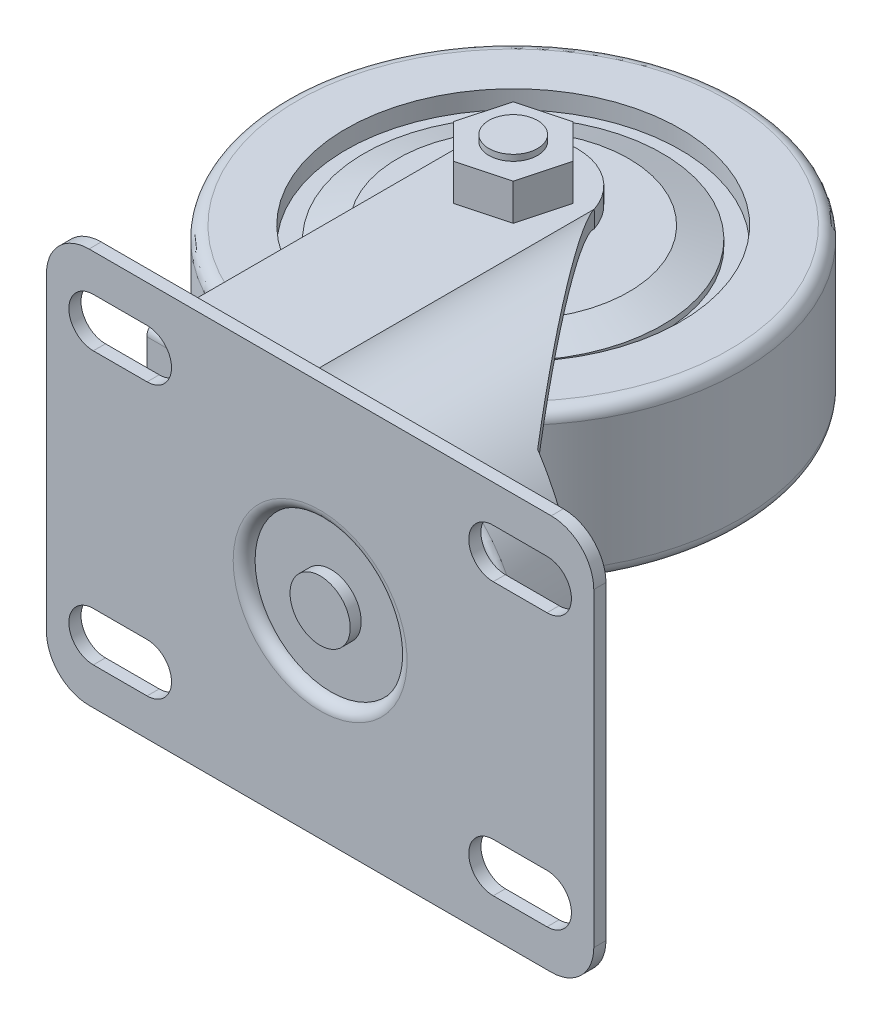
from build123d import *

# Parameters (mm, degrees)
CUT_EXTRUDE_2_DEPTH      = 85.445062578
CUT_EXTRUDE_2_DEPTH_BACK = 85.445062578
CUT_EXTRUDE_3_DEPTH      = 85.445062578
CUT_EXTRUDE_3_DEPTH_BACK = 85.445062578
EXTRUDE_6_DEPTH          = 40
EXTRUDE_7_DEPTH          = 2.8
CUT_EXTRUDE_4_DEPTH      = 103.254861861
SKETCH_18_R              = 4
EXTRUDE_8_DEPTH          = 0.3
EXTRUDE_9_DEPTH          = 6
SKETCH_20_R              = 4
EXTRUDE_10_DEPTH         = 1
EXTRUDE_START            = 0.3
SKETCH_21_R              = 4
EXTRUDE_11_DEPTH         = 0.3
SKETCH_22_R              = 5.5
EXTRUDE_12_DEPTH         = 1
FILLET_1_R               = 1
EXTRUDE_13_DEPTH         = 12.5
EXTRUDE_13_DEPTH_BACK    = 12.5
SKETCH_23_R              = 37.5
FILLET_2_R               = 2
SKETCH_24_R              = 27.5
SKETCH_24_R_2            = 24.5
CUT_EXTRUDE_5_DEPTH      = 3
CHAMFER_1_SIZE           = 2
CHAMFER_1_SIZE2          = 5.494954839
CHAMFER_2_SIZE           = 6.5
CHAMFER_2_SIZE2          = 2.365806523
SKETCH_25_R              = 6
EXTRUDE_14_DEPTH         = 3
SKETCH_33_W              = 90
SKETCH_33_H              = 65
EXTRUDE_22_DEPTH         = 2
FILLET_5_R               = 7
CUT_EXTRUDE_6_DEPTH      = 2
MIRROR_9_COPY_1_DEPTH    = 2
SKETCH_35_R              = 12.5
SKETCH_35_R_2            = 4.952549827
CUT_EXTRUDE_8_DEPTH      = 1.8
FILLET_6_R               = 1.8
CUT_EXTRUDE_9_DEPTH      = 20


# Read off the part's stored shape, not the designer's step: 加厚3
with BuildPart() as part:
    # 加厚3 outline → 加厚3 (revolve)
    with BuildSketch(Plane.XZ):
        with BuildLine():
            Line((22.51498107, -15), (22.51498107, -77))
            Line((22.51498107, -77), (24.51498107, -77))
            Line((24.51498107, -77), (24.51498107, -14))
            ThreePointArc((24.51498107, -14), (24.222087851, -13.292893219), (23.51498107, -13))
            Line((23.51498107, -13), (7.588114325, -13))
            Line((7.588114325, -13), (7.588114325, -15))
            Line((7.588114325, -15), (22.51498107, -15))
        make_face()
    revolve(axis=Axis((0, 0, 0), (0, 0, 1)))

    # 草图13 → 切除-拉伸2 (cut, two sides: drawn at the far end of the back side and taken through both)
    with BuildSketch(Plane(origin=(0, 0, 0), x_dir=(1, 0, 0), z_dir=(0, 1, 0)).offset(-CUT_EXTRUDE_2_DEPTH_BACK)):
        Polygon((-24.51498107, 77), (14.604928022, 26.16151052), (24.51498107, 23.088616514), (24.51498107, 77), align=None)
    extrude(amount=CUT_EXTRUDE_2_DEPTH + CUT_EXTRUDE_2_DEPTH_BACK, mode=Mode.SUBTRACT)

    # 草图14 → 切除-拉伸3 (cut, two sides: drawn at the far end of the back side and taken through both)
    with BuildSketch(Plane(origin=(0, 0, 0), x_dir=(1, 0, 0), z_dir=(0, 1, 0)).offset(-CUT_EXTRUDE_3_DEPTH_BACK)):
        Polygon((-16.5, 70.472511213), (-16.5, 12.57524565), (-25.363625659, 12.57524565), (-25.363625659, 79.702348144), align=None)
    extrude(amount=CUT_EXTRUDE_3_DEPTH + CUT_EXTRUDE_3_DEPTH_BACK, mode=Mode.SUBTRACT)

    # 草图15 → 凸台-拉伸6 (add)
    with BuildSketch(Plane.ZY.offset(16.5)):
        with BuildLine():
            Line((-13, -16.754233337), (-13, 16.754233337))
            add(Edge.make_bspline(
                [(-13, 16.754233337), (-13, 17.066282989), (-13.071981627, 17.383432621), (-13.278379206, 17.716834739), (-13.32508278, 17.779332115), (-13.431437184, 17.894341909), (-13.491489359, 17.946901419), (-13.686888914, 18.078052515), (-13.843794025, 18.131031324), (-14, 18.131031324)],
                knots=[0, 0, 0, 0, 0.5, 0.5, 0.625, 0.625, 0.75, 0.75, 1, 1, 1, 1], degree=3))
            Line((-14, 18.131031324), (-66.584087994, 18.131031324))
            Line((-66.584087994, 18.131031324), (-66.584087994, 15.31908524))
            Line((-66.584087994, 15.31908524), (-15, 15.31908524))
            Line((-15, 15.31908524), (-15, -15.31908524))
            Line((-15, -15.31908524), (-66.584087994, -15.31908524))
            Line((-66.584087994, -15.31908524), (-66.584087994, -18.131031324))
            Line((-66.584087994, -18.131031324), (-14, -18.131031324))
            add(Edge.make_bspline(
                [(-14, -18.131031324), (-13.842407053, -18.131031324), (-13.686831177, -18.07799673), (-13.491621762, -17.946998796), (-13.431468043, -17.894358188), (-13.325276406, -17.779558555), (-13.278292746, -17.716769524), (-13.153663134, -17.515226129), (-13.095772202, -17.370480096), (-13.018069892, -17.065294363), (-13, -16.910169012), (-13, -16.754233337)],
                knots=[0, 0, 0, 0, 0.25, 0.25, 0.375, 0.375, 0.5, 0.5, 0.75, 0.75, 1, 1, 1, 1], degree=3))
        make_face()
    extrude(amount=EXTRUDE_6_DEPTH)

    # 草图16 → 凸台-拉伸7 (add)
    with BuildSketch(Plane(origin=(0, 18.131031324, 0), x_dir=(1, 0, 0), z_dir=(0, 1, 0))):
        with BuildLine():
            Line((-16.5, 66.584087994), (-36.5, 66.584087994))
            ThreePointArc((-36.5, 66.584087994), (-26.5, 73.791086056), (-16.5, 66.584087994))
        make_face()
    extrude_7 = extrude(amount=-EXTRUDE_7_DEPTH)

    # 镜向1: 凸台-拉伸7 across plane
    add(extrude_7.mirror(Plane.ZX))

    # 草图17 → 切除-拉伸4 (cut, through all)
    with BuildSketch(Plane(origin=(0, 18.131031324, 0), x_dir=(1, 0, 0), z_dir=(0, 1, 0))):
        with BuildLine():
            Line((-36.5, 66.584087994), (-36.5, 34.244911042))
            ThreePointArc((-36.5, 34.244911042), (-41.122054778, 23.08628371), (-52.28068211, 18.464228931))
            Line((-52.28068211, 18.464228931), (-56.5, 18.464228931))
            Line((-56.5, 18.464228931), (-56.5, 66.584087994))
            Line((-56.5, 66.584087994), (-36.5, 66.584087994))
        make_face()
    extrude(amount=-CUT_EXTRUDE_4_DEPTH, mode=Mode.SUBTRACT)

    # 草图18 → 凸台-拉伸8 (add)
    with BuildSketch(Plane(origin=(0, 18.131031324, 0), x_dir=(1, 0, 0), z_dir=(0, 1, 0))):
        with Locations(Location((-26.5, 63.249885701, 0), (0, 0, 90))):
            Circle(SKETCH_18_R)
    extrude(amount=EXTRUDE_8_DEPTH)

    # 草图19 → 凸台-拉伸9 (add)
    with BuildSketch(Plane(origin=(0, 18.431031324, 0), x_dir=(1, 0, 0), z_dir=(0, 1, 0))):
        Polygon((-20.84640115, 57.589777924), (-18.771403452, 65.31599204), (-24.425002303, 70.976099816), (-32.15359885, 68.909993477), (-34.228596548, 61.183779361), (-28.574997697, 55.523671585), align=None)
    extrude(amount=EXTRUDE_9_DEPTH)

    # 草图20 → 凸台-拉伸10 (add)
    with BuildSketch(Plane(origin=(0, 24.431031324, 0), x_dir=(1, 0, 0), z_dir=(0, 1, 0))):
        with Locations(Location((-26.5, 63.249885701, 0), (0, 0, 90))):
            Circle(SKETCH_20_R)
    extrude(amount=EXTRUDE_10_DEPTH)

    # 草图21 → 凸台-拉伸11 (add)
    with BuildSketch(Plane.XZ.offset(18.131031324).offset(EXTRUDE_START)):
        with Locations(Location((-26.5, -63.249885701, 0), (0, 0, 270))):
            Circle(SKETCH_21_R)
    extrude(amount=-EXTRUDE_11_DEPTH)

    # 草图22 → 凸台-拉伸12 (add)
    with BuildSketch(Plane.XZ.offset(18.431031324)):
        with Locations(Location((-26.5, -63.249885701, 0), (0, 0, 270))):
            Circle(SKETCH_22_R)
    extrude(amount=EXTRUDE_12_DEPTH)

    # 圆角1
    fillet_1_edges = [part.edges().sort_by_distance(p)[0] for p in [
        (-26.5, -19.431031324, -57.749885701),
    ]]
    fillet(fillet_1_edges, radius=FILLET_1_R - 0.0001)  # a hair under: the kernel refuses the full size



with BuildPart() as body_2:
    # 草图23 → 凸台-拉伸13 (new, two sides: drawn at the far end of the back side and taken through both)
    with BuildSketch(Plane(origin=(0, 0, 0), x_dir=(1, 0, 0), z_dir=(0, 1, 0)).offset(-EXTRUDE_13_DEPTH_BACK)):
        with Locations(Location((-26.5, 63.249885701, 0), (0, 0, 270))):
            Circle(SKETCH_23_R)
    extrude(amount=EXTRUDE_13_DEPTH + EXTRUDE_13_DEPTH_BACK)

    # 圆角2
    fillet_2_edges = [body_2.edges().sort_by_distance(p)[0] for p in [
        (-26.5, -12.5, -100.749885701),
        (-26.5, 12.5, -100.749885701),
    ]]
    fillet(fillet_2_edges, radius=FILLET_2_R)

    # 草图24 → 切除-拉伸5 (cut)
    with BuildSketch(Plane(origin=(0, 12.5, 0), x_dir=(1, 0, 0), z_dir=(0, 1, 0))):
        with Locations(Location((-26.5, 63.249885701, 0), (0, 0, 270))):
            Circle(SKETCH_24_R)
        with Locations(Location((-26.5, 63.249885701, 0), (0, 0, 270))):
            Circle(SKETCH_24_R_2, mode=Mode.SUBTRACT)
    cut_extrude_5 = extrude(amount=-CUT_EXTRUDE_5_DEPTH, mode=Mode.SUBTRACT)

    # 镜向2: 切除-拉伸5 across plane
    add(cut_extrude_5.mirror(Plane.ZX), mode=Mode.SUBTRACT)

    # 倒角1
    chamfer_1_edges = [body_2.edges().sort_by_distance(p)[0] for p in [
        (-26.5, 12.5, -87.749885701),
    ]]
    chamfer_1_side = [body_2.faces().sort_by_distance(p)[0] for p in [
        (-26.5, 11, -87.749885701),
    ]]
    chamfer(chamfer_1_edges, length=CHAMFER_1_SIZE, length2=CHAMFER_1_SIZE2, reference=chamfer_1_side[0])

    # 倒角2
    chamfer_2_edges = [body_2.edges().sort_by_distance(p)[0] for p in [
        (-26.5, -12.5, -87.749885701),
    ]]
    chamfer_2_side = [body_2.faces().sort_by_distance(p)[0] for p in [
        (-26.5, -12.5, -63.249885701),
    ]]
    chamfer(chamfer_2_edges, length=CHAMFER_2_SIZE, length2=CHAMFER_2_SIZE2, reference=chamfer_2_side[0])


with BuildPart() as part_1:
    add(part.part)

    add(body_2.part)  # 凸台-拉伸14 merges body 2
    # 草图25 → 凸台-拉伸14 (add)
    with BuildSketch(Plane(origin=(0, 12.5, 0), x_dir=(1, 0, 0), z_dir=(0, 1, 0))):
        with Locations(Location((-26.5, 63.249885701, 0), (0, 0, 33.758968922))):
            Circle(SKETCH_25_R)
    extrude_14 = extrude(amount=EXTRUDE_14_DEPTH)

    # 镜向5: 凸台-拉伸14 across plane
    add(extrude_14.mirror(Plane.ZX))

    # 草图36 → 切除-拉伸9 (cut)
    with BuildSketch(Plane.ZY.offset(56.5)):
        Polygon((-69.119671406, -14.511109391), (-69.119671406, -27.940534837), (-12.081507286, -27.940534837), (-12.081507286, 31.901575255), (-69.119671406, 31.901575255), (-69.119671406, 14.487595006), (-19.386524424, 14.487595006), (-19.386524424, -14.511109391), align=None)
    extrude(amount=-CUT_EXTRUDE_9_DEPTH, mode=Mode.SUBTRACT)


with BuildPart() as body_2_2:
    # 草图33 → 凸台-拉伸22 (new body)
    with BuildSketch(Plane.XY.offset(-7)):
        Rectangle(SKETCH_33_W, SKETCH_33_H)
    extrude(amount=EXTRUDE_22_DEPTH)

    # 圆角5
    fillet_5_edges = [body_2_2.edges().sort_by_distance(p)[0] for p in [
        (45, -32.5, -6),
        (-45, -32.5, -6),
        (-45, 32.5, -6),
        (45, 32.5, -6),
    ]]
    fillet(fillet_5_edges, radius=FILLET_5_R)

    # 草图34 → 切除-拉伸6 (cut)
    with BuildSketch(Plane.XY.offset(-5)):
        with BuildLine():
            Line((-37.302288021, 26.384280733), (-28.461004649, 26.384280733))
            ThreePointArc((-28.461004649, 26.384280733), (-24.44223948, 22.365515564), (-28.461004649, 18.346750395))
            Line((-28.461004649, 18.346750395), (-37.302288021, 18.346750395))
            ThreePointArc((-37.302288021, 18.346750395), (-41.32105319, 22.365515564), (-37.302288021, 26.384280733))
        make_face()
    cut_extrude_6 = extrude(amount=-CUT_EXTRUDE_6_DEPTH, mode=Mode.SUBTRACT)

    # 镜向8: 切除-拉伸6 across plane
    add(cut_extrude_6.mirror(Plane.ZX), mode=Mode.SUBTRACT)

    # 镜向9: 切除-拉伸6 across plane
    add(cut_extrude_6.mirror(Plane(origin=(0, 0, 0), x_dir=(0, 0, 1), z_dir=(1, 0, 0))), mode=Mode.SUBTRACT)

    # 镜向9 copy 1 sketch → 镜向9 copy 1 (cut)
    with BuildSketch(Plane(origin=(0, 0, -5), x_dir=(-1, 0, 0), z_dir=(0, 0, 1))):
        with BuildLine():
            Line((-37.302288021, 26.384280733), (-28.461004649, 26.384280733))
            ThreePointArc((-28.461004649, 26.384280733), (-24.44223948, 22.365515564), (-28.461004649, 18.346750395))
            Line((-28.461004649, 18.346750395), (-37.302288021, 18.346750395))
            ThreePointArc((-37.302288021, 18.346750395), (-41.32105319, 22.365515564), (-37.302288021, 26.384280733))
        make_face()
    extrude(amount=-MIRROR_9_COPY_1_DEPTH, mode=Mode.SUBTRACT)

    # 草图35 → 切除-拉伸8 (cut)
    with BuildSketch(Plane.XY.offset(-5)):
        Circle(SKETCH_35_R)
        Circle(SKETCH_35_R_2, mode=Mode.SUBTRACT)
    extrude(amount=-CUT_EXTRUDE_8_DEPTH, mode=Mode.SUBTRACT)

    # 圆角6
    fillet_6_edges = [body_2_2.edges().sort_by_distance(p)[0] for p in [
        (-12.5, 0, -5),
    ]]
    fillet(fillet_6_edges, radius=FILLET_6_R - 0.0001)  # a hair under: the kernel refuses the full size


solid = Compound([part_1.part, body_2_2.part])
